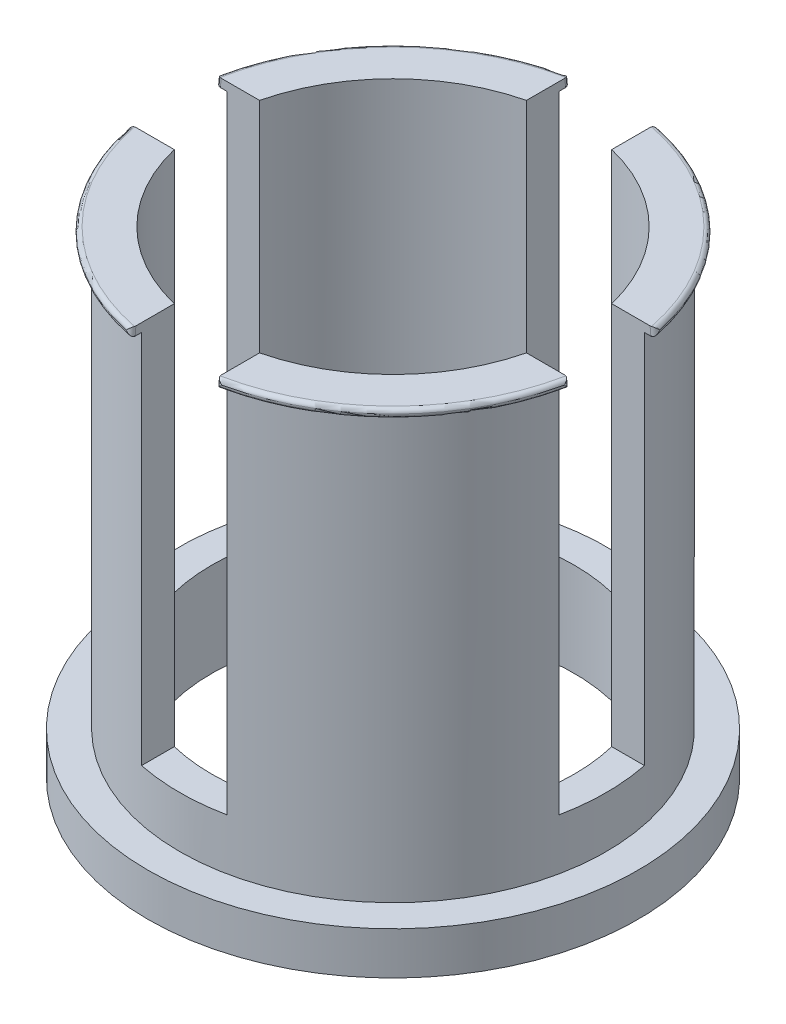
from build123d import *

# Parameters (mm, degrees)
SKETCH1_R               = 12.7
BOSS_EXTRUDE1_DEPTH     = 25.4
SKETCH2_R               = 13.335
BOSS_EXTRUDE2_DEPTH     = 0.508
DRAFT1_ANGLE            = 5
SKETCH5_R               = 14.605
BOSS_EXTRUDE3_DEPTH     = 2.54
CUT_EXTRUDE1_DEPTH      = 36.155380157
CUT_EXTRUDE1_DEPTH_BACK = 36.155380157
SKETCH3_R               = 10.795
SKETCH4_W               = 30.48
SKETCH4_H               = 5.08
SKETCH4_W_2             = 5.08
SKETCH4_H_2             = 30.48
CUT_EXTRUDE2_DEPTH      = 22.86
FILLET3_R               = 0.254


with BuildPart() as part:
    # Sketch1 → Boss-Extrude1 (new body)
    with BuildSketch(Plane(origin=(0, 0, 0), x_dir=(1, 0, 0), z_dir=(0, 1, 0))):
        with Locations(Location((0, 0, 0), (0, 0, 270))):
            Circle(SKETCH1_R)
    extrude(amount=BOSS_EXTRUDE1_DEPTH)

    # Sketch2 → Boss-Extrude2 (add)
    with BuildSketch(Plane(origin=(0, 25.4, 0), x_dir=(1, 0, 0), z_dir=(0, 1, 0))):
        with Locations(Location((0, 0, 0), (0, 0, 270))):
            Circle(SKETCH2_R)
    extrude(amount=BOSS_EXTRUDE2_DEPTH)

    # Draft1
    draft1_faces = [part.faces().sort_by_distance(p)[0] for p in [
        (0, 25.654, -13.335),
    ]]
    draft(draft1_faces, Plane.ZX.offset(25.908), DRAFT1_ANGLE)

    # Sketch5 → Boss-Extrude3 (add)
    with BuildSketch(Plane.XZ):
        with Locations(Location((0, 0, 0), (0, 0, 270))):
            Circle(SKETCH5_R)
    extrude(amount=BOSS_EXTRUDE3_DEPTH)

    # Sketch3 → Cut-Extrude1 (cut, two sides: drawn at the far end of the back side and taken through both)
    with BuildSketch(Plane(origin=(0, 25.908, 0), x_dir=(1, 0, 0), z_dir=(0, 1, 0)).offset(-CUT_EXTRUDE1_DEPTH_BACK)):
        with Locations(Location((0, 0, 0), (0, 0, 270))):
            Circle(SKETCH3_R)
    extrude(amount=CUT_EXTRUDE1_DEPTH + CUT_EXTRUDE1_DEPTH_BACK, mode=Mode.SUBTRACT)

    # Sketch4 → Cut-Extrude2 (cut)
    with BuildSketch(Plane(origin=(0, 25.908, 0), x_dir=(1, 0, 0), z_dir=(0, 1, 0))):
        Rectangle(SKETCH4_W, SKETCH4_H)
        Rectangle(SKETCH4_W_2, SKETCH4_H_2)
    extrude(amount=-CUT_EXTRUDE2_DEPTH, mode=Mode.SUBTRACT)

    # Fillet3
    fillet3_edges = [part.edges().sort_by_distance(p)[0] for p in [
        (-2.54, 25.654219214, -13.113476672),
        (-2.54, 25.654219214, 13.113476672),
        (-9.460695751, 25.4, 9.460695751),
        (-13.113476672, 25.654219214, 2.54),
        (13.113476672, 25.654219214, 2.54),
        (-9.429268927, 25.908, 9.429268927),
        (-9.460695751, 25.4, -9.460695751),
        (-9.429268927, 25.908, -9.429268927),
        (-13.113476672, 25.654219214, -2.54),
        (13.113476672, 25.654219214, -2.54),
        (9.429268927, 25.908, -9.429268927),
        (2.54, 25.654219214, -13.113476672),
        (2.54, 25.654219214, 13.113476672),
        (9.460695751, 25.4, -9.460695751),
        (9.460695751, 25.4, 9.460695751),
        (9.429268927, 25.908, 9.429268927),
    ]]
    fillet(fillet3_edges, radius=FILLET3_R - 0.0001)  # a hair under: the kernel refuses the full size


solid = part.part
